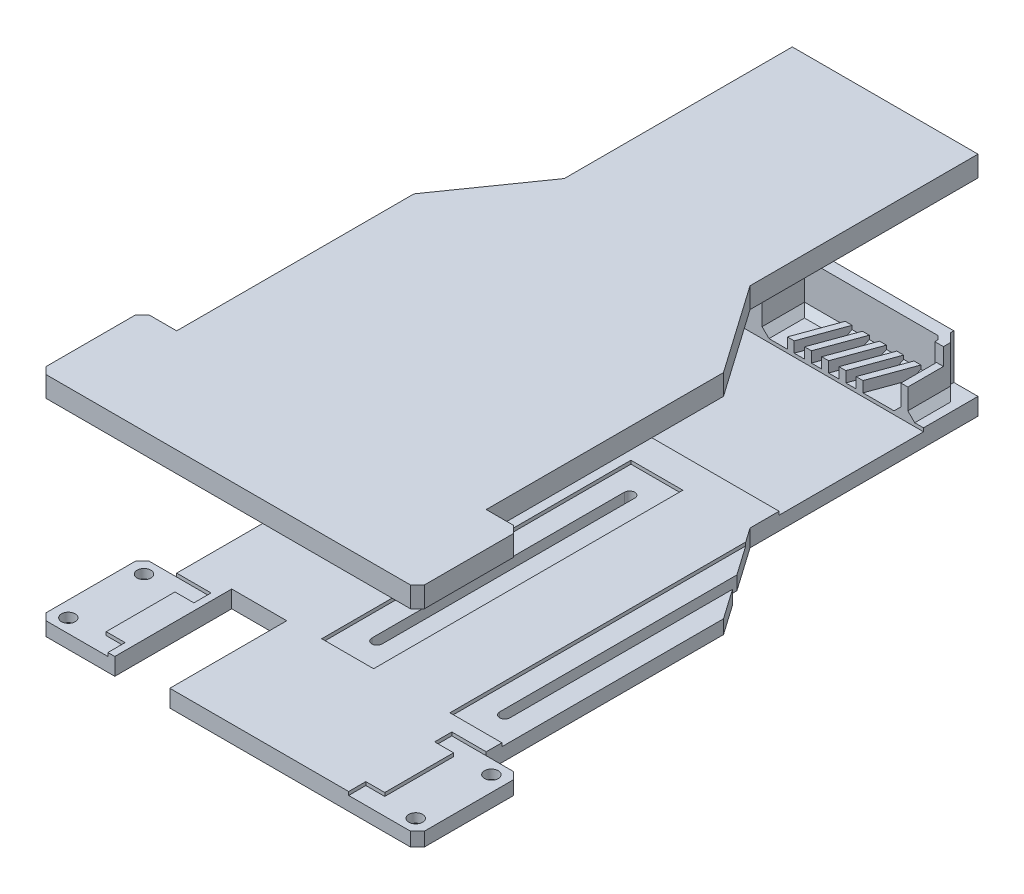
from build123d import *

# Parameters (mm, degrees)
SKETCH1_W                     = 90
SKETCH1_H                     = 190
BOSS_EXTRUDE1_DEPTH           = 5
SKETCH2_W                     = 10
SKETCH2_H                     = 30
BOSS_EXTRUDE2_DEPTH           = 5
CHAMFER1_SIZE                 = 2
SKETCH3_W                     = 16
SKETCH3_H                     = 34
CUT_EXTRUDE1_DEPTH            = 50
SKETCH4_W                     = 90
SKETCH4_H                     = 42
CUT_EXTRUDE2_DEPTH            = 1
SKETCH7_W                     = 15.1
SKETCH7_H                     = 89.916335477
CUT_EXTRUDE7_DEPTH            = 1
BOSS_EXTRUDE4_START           = 5
BOSS_EXTRUDE4_DEPTH           = 13
BOSS_EXTRUDE5_DEPTH           = 3.1
CUT_EXTRUDE11_START           = 5
CUT_EXTRUDE11_DEPTH           = 1
CUT_EXTRUDE12_DEPTH           = 112.23848255
CUT_EXTRUDE12_DEPTH_BACK      = 112.23848255
BOSS_EXTRUDE6_DEPTH           = 1
CHAMFER4_SIZE                 = 2
CUT_EXTRUDE13_REACH           = 114.094
SKETCH23_R                    = 2
CUT_EXTRUDE14_DEPTH           = 113.093556715
CUT_EXTRUDE14_DEPTH_BACK      = 113.093556715
SKETCH27_W                    = 2.002698481
SKETCH27_H                    = 10.340179912
BOSS_EXTRUDE7_DEPTH           = 8
CHAMFER5_SIZE                 = 2
CHAMFER6_SIZE                 = 15.045922045
CHAMFER6_SIZE_2               = 4.6
CHAMFER7_SIZE                 = 2
CSK_FOR_M3_SFHCS1_D           = 3.4
CSK_FOR_M3_SFHCS1_DEPTH       = 4
CSK_FOR_M3_SFHCS1_CSINK_D     = 6.72
CSK_FOR_M3_SFHCS1_CSINK_ANGLE = 90
CSK_FOR_M3_SFHCS1_TIP         = 1.021463052
BOSS_EXTRUDE8_START           = 60
BOSS_EXTRUDE8_DEPTH           = 4
BOSS_EXTRUDE9_DEPTH           = 2


with BuildPart() as part:
    # Sketch1 → Boss-Extrude1 (new body)
    with BuildSketch(Plane(origin=(0, 0, 0), x_dir=(1, 0, 0), z_dir=(0, 1, 0))):
        Rectangle(SKETCH1_W, SKETCH1_H)
    extrude(amount=BOSS_EXTRUDE1_DEPTH)

    # Sketch2 → Boss-Extrude2 (add)
    with BuildSketch(Plane(origin=(0, 0, 0), x_dir=(1, 0, 0), z_dir=(0, 1, 0))):
        with Locations((-50, -80)):
            Rectangle(SKETCH2_W, SKETCH2_H)
        with Locations((50, -80)):
            Rectangle(SKETCH2_W, SKETCH2_H)
    extrude(amount=BOSS_EXTRUDE2_DEPTH)

    # Chamfer1
    chamfer1_edges = [part.edges().sort_by_distance(p)[0] for p in [
        (-55, 2.5, 65),
        (-55, 2.5, 95),
        (55, 2.5, 95),
        (55, 2.5, 65),
    ]]
    chamfer(chamfer1_edges, length=CHAMFER1_SIZE)

    # Sketch3 → Cut-Extrude1 (cut)
    with BuildSketch(Plane(origin=(0, 5, 0), x_dir=(1, 0, 0), z_dir=(0, 1, 0))):
        with Locations((-25, -78)):
            Rectangle(SKETCH3_W, SKETCH3_H)
    extrude(amount=-CUT_EXTRUDE1_DEPTH, mode=Mode.SUBTRACT)

    # Sketch4 → Cut-Extrude2 (cut)
    with BuildSketch(Plane(origin=(0, 5, 0), x_dir=(1, 0, 0), z_dir=(0, 1, 0))):
        with Locations((0, 59.159820088)):
            Rectangle(SKETCH4_W, SKETCH4_H)
    extrude(amount=-CUT_EXTRUDE2_DEPTH, mode=Mode.SUBTRACT)

    # Sketch7 → Cut-Extrude7 (cut)
    with BuildSketch(Plane(origin=(0, 5, 0), x_dir=(1, 0, 0), z_dir=(0, 1, 0))):
        with Locations((37.45, -15.495273531)):
            Rectangle(SKETCH7_W, SKETCH7_H)
        with Locations((0.16773297, -15.495273531)):
            Rectangle(SKETCH7_W, SKETCH7_H)
    extrude(amount=-CUT_EXTRUDE7_DEPTH, mode=Mode.SUBTRACT)

    # Sketch17 → Boss-Extrude4 (add)
    with BuildSketch(Plane(origin=(0, 0, 0), x_dir=(1, 0, 0), z_dir=(0, 1, 0)).offset(BOSS_EXTRUDE4_START)):
        Polygon((-22.440023983, 80.159820088), (-19.940023983, 80.159820088), (-19.940023983, 92.499820088), (18.940023983, 92.499820088), (19.940023983, 91.499820088), (19.940023983, 90.5), (22.440023983, 90.5), (22.440023983, 92.535353994), (19.975557889, 94.999820088), (-22.440023983, 94.999820088), align=None)
    extrude(amount=BOSS_EXTRUDE4_DEPTH)

    # Sketch18 → Boss-Extrude5 (add)
    with BuildSketch(Plane(origin=(0, 5, 0), x_dir=(1, 0, 0), z_dir=(0, 1, 0))):
        Polygon((-12.599634528, 80.159820088), (-10.599634528, 80.159820088), (-6.108241837, 92.499820088), (-8.108241837, 92.499820088), align=None)
        Polygon((-3.108241837, 92.499820088), (-7.599634528, 80.159820088), (-5.599634528, 80.159820088), (-1.108241837, 92.499820088), align=None)
        Polygon((1.891758163, 92.499820088), (-2.599634528, 80.159820088), (-0.599634528, 80.159820088), (3.891758163, 92.499820088), align=None)
        Polygon((6.891758163, 92.499820088), (2.400365472, 80.159820088), (4.400365472, 80.159820088), (8.891758163, 92.499820088), align=None)
        Polygon((11.891758163, 92.499820088), (7.400365472, 80.159820088), (9.400365472, 80.159820088), (13.891758163, 92.499820088), align=None)
    extrude(amount=BOSS_EXTRUDE5_DEPTH)

    # Sketch19 → Cut-Extrude11 (cut)
    with BuildSketch(Plane(origin=(0, 0, 0), x_dir=(1, 0, 0), z_dir=(0, 1, 0)).offset(CUT_EXTRUDE11_START)):
        Polygon((-35, -65), (-35, -70), (-40.5, -70), (-40.5, -90), (-35, -90), (-35, -95), (-53, -95), (-55, -93), (-55, -67), (-53, -65), align=None)
    cut_extrude11 = extrude(amount=-CUT_EXTRUDE11_DEPTH, mode=Mode.SUBTRACT)

    # Mirror1: Cut-Extrude11 across plane
    add(cut_extrude11.mirror(Plane(origin=(0, 0, 0), x_dir=(0, 0, 1), z_dir=(1, 0, 0))), mode=Mode.SUBTRACT)

    # Sketch20 → Cut-Extrude12 (cut, two sides: drawn at the far end of the back side and taken through both)
    with BuildSketch(Plane(origin=(0, 0, 0), x_dir=(1, 0, 0), z_dir=(0, 1, 0)).offset(-CUT_EXTRUDE12_DEPTH_BACK)):
        Polygon((-27, 29.706664121), (-45, 4), (-45, 95), (-27, 95), align=None)
        Polygon((27, 95), (27, 29.706664121), (45, 4), (45, 95), align=None)
    extrude(amount=CUT_EXTRUDE12_DEPTH + CUT_EXTRUDE12_DEPTH_BACK, mode=Mode.SUBTRACT)

    # Sketch22 → Boss-Extrude6 (add)
    with BuildSketch(Plane(origin=(0, 0, -94.999820088), x_dir=(-1, 0, 0), z_dir=(0, 0, -1))):
        Polygon((-19.975557889, 5), (-27, 5), (-27, 0), (27, 0), (27, 5), (22.440023983, 5), (22.440023983, 18), (-19.975557889, 18), align=None)
    extrude(amount=BOSS_EXTRUDE6_DEPTH)

    # Chamfer4
    chamfer4_edges = [part.edges().sort_by_distance(p)[0] for p in [
        (-19.940023983, 5, -86.329820088),
        (-14.02413291, 5, -92.499820088),
        (-4.608241837, 5, -92.499820088),
        (0.391758163, 5, -92.499820088),
        (5.391758163, 5, -92.499820088),
        (10.391758163, 5, -92.499820088),
    ]]
    chamfer(chamfer4_edges, length=CHAMFER4_SIZE)

    # Sketch23 → Cut-Extrude13 (cut, up to next)
    with BuildSketch(Plane.XZ, mode=Mode.PRIVATE) as cut_extrude13_sk1:
        with Locations(Location((-50.5, 91, 0), (0, 0, 270))):
            Circle(SKETCH23_R)
    cut_extrude13_tool1 = extrude(cut_extrude13_sk1.sketch, amount=-CUT_EXTRUDE13_REACH, mode=Mode.PRIVATE) & part.part
    # Sketch23 → Cut-Extrude13 (cut, up to next)
    with BuildSketch(Plane.XZ, mode=Mode.PRIVATE) as cut_extrude13_sk2:
        with Locations(Location((-50.5, 69, 0), (0, 0, 270))):
            Circle(SKETCH23_R)
    cut_extrude13_tool2 = extrude(cut_extrude13_sk2.sketch, amount=-CUT_EXTRUDE13_REACH, mode=Mode.PRIVATE) & part.part
    # Sketch23 → Cut-Extrude13 (cut, up to next)
    with BuildSketch(Plane.XZ, mode=Mode.PRIVATE) as cut_extrude13_sk3:
        with Locations(Location((50.5, 69, 0), (0, 0, 270))):
            Circle(SKETCH23_R)
    cut_extrude13_tool3 = extrude(cut_extrude13_sk3.sketch, amount=-CUT_EXTRUDE13_REACH, mode=Mode.PRIVATE) & part.part
    # Sketch23 → Cut-Extrude13 (cut, up to next)
    with BuildSketch(Plane.XZ, mode=Mode.PRIVATE) as cut_extrude13_sk4:
        with Locations(Location((50.5, 91, 0), (0, 0, 270))):
            Circle(SKETCH23_R)
    cut_extrude13_tool4 = extrude(cut_extrude13_sk4.sketch, amount=-CUT_EXTRUDE13_REACH, mode=Mode.PRIVATE) & part.part
    add(cut_extrude13_tool1.solids().sort_by_distance((-50.5, 0, 91))[0], mode=Mode.SUBTRACT)
    add(cut_extrude13_tool2.solids().sort_by_distance((-50.5, 0, 69))[0], mode=Mode.SUBTRACT)
    add(cut_extrude13_tool3.solids().sort_by_distance((50.5, 0, 69))[0], mode=Mode.SUBTRACT)
    add(cut_extrude13_tool4.solids().sort_by_distance((50.5, 0, 91))[0], mode=Mode.SUBTRACT)

    # Sketch25 → Cut-Extrude14 (cut, two sides: drawn at the far end of the back side and taken through both)
    with BuildSketch(Plane.XZ.offset(-CUT_EXTRUDE14_DEPTH_BACK)):
        with BuildLine():
            Line((1.71773297, 51.988728589), (1.71773297, -21.462894208))
            ThreePointArc((1.71773297, -21.462894208), (0.21773297, -22.962894208), (-1.28226703, -21.462894208))
            Line((-1.28226703, -21.462894208), (-1.28226703, 51.988728589))
            ThreePointArc((-1.28226703, 51.988728589), (0.21773297, 53.488728589), (1.71773297, 51.988728589))
        make_face()
        with BuildLine():
            Line((38.9, 51.988728589), (38.9, -21.462894208))
            ThreePointArc((38.9, -21.462894208), (37.4, -22.962894208), (35.9, -21.462894208))
            Line((35.9, -21.462894208), (35.9, 51.988728589))
            ThreePointArc((35.9, 51.988728589), (37.4, 53.488728589), (38.9, 51.988728589))
        make_face()
    extrude(amount=CUT_EXTRUDE14_DEPTH + CUT_EXTRUDE14_DEPTH_BACK, mode=Mode.SUBTRACT)

    # Sketch27 → Boss-Extrude7 (add)
    with BuildSketch(Plane(origin=(0, 5, 0), x_dir=(1, 0, 0), z_dir=(0, 1, 0))):
        with Locations((21.438674742, 85.329910044)):
            Rectangle(SKETCH27_W, SKETCH27_H)
    extrude(amount=BOSS_EXTRUDE7_DEPTH)

    # Chamfer5
    chamfer5_edges = [part.edges().sort_by_distance(p)[0] for p in [
        (22.440023983, 5, -86.347587041),
    ]]
    chamfer(chamfer5_edges, length=CHAMFER5_SIZE)

    # Chamfer6
    # the kernel refuses this chamfer: 15.045922045, 4.6 mm, written as the material it adds along each edge
    with BuildSketch(Plane(origin=(-22.440023983, 5, -80.159820088), x_dir=(0.011263281176818154, 0.9999365672367082, 0), z_dir=(0, 0, -1))) as chamfer6_piece_1_section:
        Polygon((CHAMFER6_SIZE * 0.999936567239, -CHAMFER6_SIZE * 0.0112632811768), (-CHAMFER6_SIZE_2 * 0.0112632811768, -CHAMFER6_SIZE_2 * 0.999936567237), (0, 0), align=None)
    chamfer6_piece_1 = extrude(amount=15.84, mode=Mode.PRIVATE)
    chamfer6_piece_1 = split(chamfer6_piece_1, bisect_by=Plane(origin=(-23.998082586, 18, -88.079820088), z_dir=(0, -1, 0)), keep=Keep.TOP, mode=Mode.PRIVATE)
    chamfer6_piece_1 = split(chamfer6_piece_1, bisect_by=Plane(origin=(-27, 9.852411417, -88.079820088), z_dir=(1, 0, 0)), keep=Keep.TOP, mode=Mode.PRIVATE)
    add(chamfer6_piece_1)

    # Chamfer7
    # the kernel refuses this chamfer: 2 mm, written as the material it adds along each edge
    with BuildSketch(Plane(origin=(8.748392187, 5, -92.499820088), x_dir=(-2.155664593802373e-14, -0.027495876610586414, 0.9996219169112968), z_dir=(1, 0, 0))) as chamfer7_piece_1_section:
        Polygon((CHAMFER7_SIZE * 0.999621916911, -CHAMFER7_SIZE * 0.0274958766106), (-CHAMFER7_SIZE * 0.0274958766106, -CHAMFER7_SIZE * 0.999621916911), (0, 0), align=None)
    chamfer7_piece_1 = extrude(amount=15.334997772, mode=Mode.PRIVATE)
    chamfer7_piece_1 = split(chamfer7_piece_1, bisect_by=Plane(origin=(20.49595334, 8.944070643, -90.499940029), z_dir=(-0.7071067811865476, -0.7071067811865476, -1.2691553730131522e-15)), keep=Keep.TOP, mode=Mode.PRIVATE)
    chamfer7_piece_1 = split(chamfer7_piece_1, bisect_by=Plane(origin=(20.513690307, 5.000059971, -94.46168767), z_dir=(-0.7071067811865465, 0, 0.7071067811865486)), keep=Keep.TOP, mode=Mode.PRIVATE)
    add(chamfer7_piece_1)
    with BuildSketch(Plane(origin=(20.437325502, 5, -80.159820088), x_dir=(-0.9996219169112968, -0.02749587661058651, 0), z_dir=(0, 0, -1))) as chamfer7_piece_2_section:
        Polygon((CHAMFER7_SIZE * 0.999621916911, CHAMFER7_SIZE * 0.0274958766106), (-CHAMFER7_SIZE * 0.0274958766106, CHAMFER7_SIZE * 0.999621916911), (0, 0), align=None)
    chamfer7_piece_2 = extrude(amount=15.483545888, mode=Mode.PRIVATE)
    chamfer7_piece_2 = split(chamfer7_piece_2, bisect_by=Plane(origin=(24.542296211, 5.500899494, -90.433081766), z_dir=(-0.7071067811865465, 0, 0.7071067811865486)), keep=Keep.TOP, mode=Mode.PRIVATE)
    add(chamfer7_piece_2)

    # CSK for M3 SFHCS1
    with Locations(Plane(origin=(0, 0, 0), x_dir=(-1, 0, 0), z_dir=(0, -1, 0))):
        with Locations((-50.5, -91), (-50.5, -69), (50.5, -69), (50.5, -91)):
            CounterSinkHole(CSK_FOR_M3_SFHCS1_D / 2, CSK_FOR_M3_SFHCS1_CSINK_D / 2, depth=CSK_FOR_M3_SFHCS1_DEPTH, counter_sink_angle=CSK_FOR_M3_SFHCS1_CSINK_ANGLE)
            with Locations((0, 0, -(CSK_FOR_M3_SFHCS1_DEPTH + CSK_FOR_M3_SFHCS1_TIP / 2))):  # 118° drill point
                Cone(0, CSK_FOR_M3_SFHCS1_D / 2, CSK_FOR_M3_SFHCS1_TIP, mode=Mode.SUBTRACT)


with BuildPart() as body_2:
    # Sketch31 → Boss-Extrude8 (new body)
    with BuildSketch(Plane(origin=(0, 0, 0), x_dir=(1, 0, 0), z_dir=(0, 1, 0)).offset(BOSS_EXTRUDE8_START)):
        Polygon((-27, 95.999820088), (-27, 29.706664121), (-45, 4), (-45, -65), (-53, -65), (-55, -67), (-55, -93), (-53, -95), (53, -95), (55, -93), (55, -67), (53, -65), (45, -65), (45, 4), (27, 29.706664121), (27, 95.999820088), align=None)
    extrude(amount=BOSS_EXTRUDE8_DEPTH)

    # Sketch32 → Boss-Extrude9 (add)
    with BuildSketch(Plane(origin=(0, 64, 0), x_dir=(1, 0, 0), z_dir=(0, 1, 0))):
        Polygon((27, 29.706664121), (27, 95.999820088), (-27, 95.999820088), (-27, 29.706664121), (-45, 4), (-45, -65), (-53, -65), (-55, -67), (-55, -93), (-53, -95), (53, -95), (55, -93), (55, -67), (53, -65), (45, -65), (45, 4), align=None)
    extrude(amount=BOSS_EXTRUDE9_DEPTH)


solid = Compound([part.part, body_2.part])
